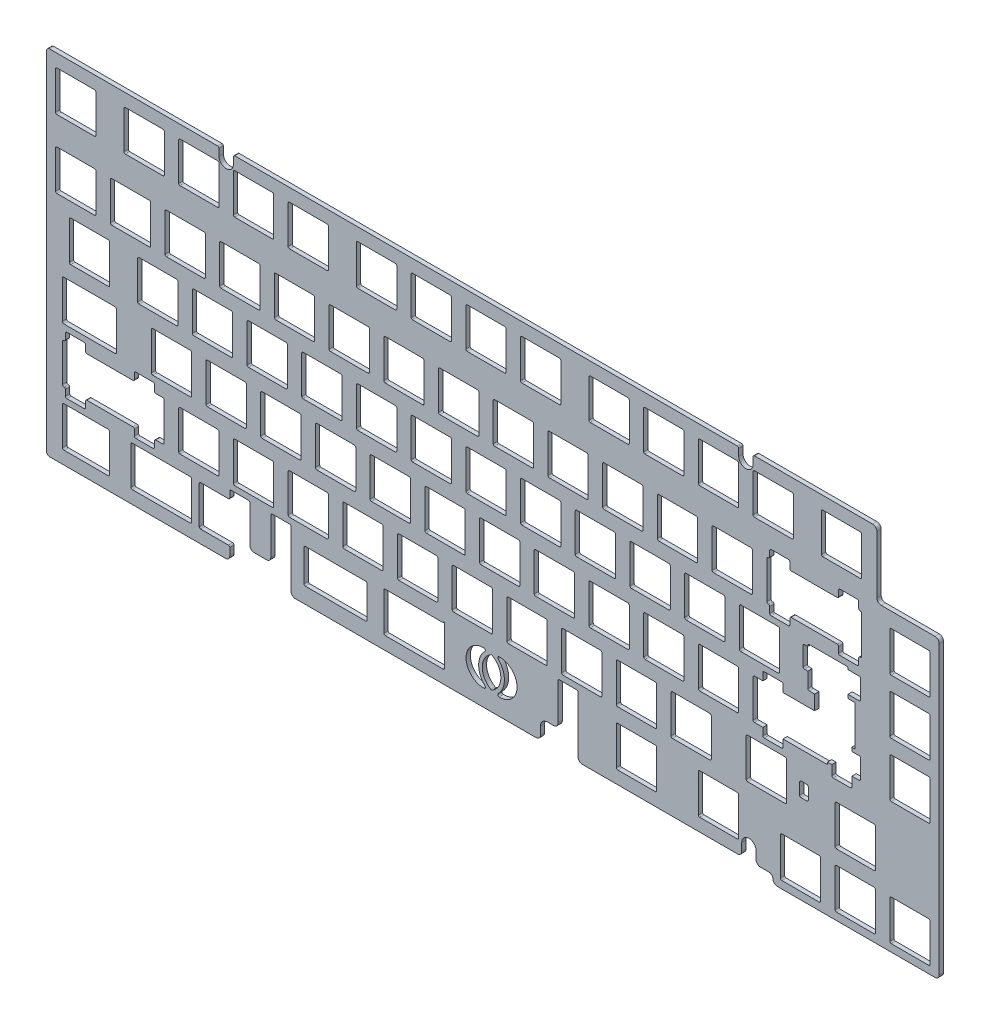
from build123d import *

# Parameters (mm, degrees)
BOSS_EXTRUDE1_DEPTH = 1.5
CUT_EXTRUDE1_DEPTH  = 10
FILLET1_R           = 0.5


with BuildPart() as part:
    # Model → Boss-Extrude1 (new body)
    with BuildSketch(Plane.XY):
        with BuildLine():
            ThreePointArc((9.955298424, 130.969514546), (9.177480965, 130.647332005), (8.855298424, 129.869514546))
            Line((8.855298424, 129.869514546), (8.855298424, 9.057014546))
            ThreePointArc((8.855298424, 9.057014546), (9.177480965, 8.279197086), (9.955298424, 7.957014546))
            Line((9.955298424, 7.957014546), (71.206983424, 7.957014546))
            ThreePointArc((71.206983424, 7.957014546), (72.267643596, 8.396354374), (72.706983424, 9.457014546))
            Line((72.706983424, 9.457014546), (72.706983424, 11.957014546))
            ThreePointArc((72.706983424, 11.957014546), (72.560536815, 12.310567936), (72.206983424, 12.457014546))
            Line((72.206983424, 12.457014546), (62.559375038, 12.457014546))
            ThreePointArc((62.559375038, 12.457014546), (62.205821647, 12.603461155), (62.059375038, 12.957014546))
            Line((62.059375038, 12.957014546), (62.059375038, 25.957014546))
            ThreePointArc((62.059375038, 25.957014546), (62.205821647, 26.310567936), (62.559375038, 26.457014546))
            Line((62.559375038, 26.457014546), (72.206983424, 26.457014546))
            ThreePointArc((72.206983424, 26.457014546), (72.560536815, 26.603461155), (72.706983424, 26.957014546))
            Line((72.706983424, 26.957014546), (72.706983424, 28.958014546))
            ThreePointArc((72.706983424, 28.958014546), (72.853430033, 29.311567936), (73.206983424, 29.458014546))
            Line((73.206983424, 29.458014546), (79.206983424, 29.458014546))
            ThreePointArc((79.206983424, 29.458014546), (79.560536815, 29.311567936), (79.706983424, 28.958014546))
            Line((79.706983424, 28.958014546), (79.706983424, 16.157014546))
            ThreePointArc((79.706983424, 16.157014546), (80.146323252, 15.096354374), (81.206983424, 14.657014546))
            Line((81.206983424, 14.657014546), (85.495873424, 14.657014546))
            ThreePointArc((85.495873424, 14.657014546), (86.556533596, 15.096354374), (86.995873424, 16.157014546))
            Line((86.995873424, 16.157014546), (86.995873424, 28.958014546))
            ThreePointArc((86.995873424, 28.958014546), (87.142320033, 29.311567936), (87.495873424, 29.458014546))
            Line((87.495873424, 29.458014546), (93.495873424, 29.458014546))
            ThreePointArc((93.495873424, 29.458014546), (93.849426815, 29.311567936), (93.995873424, 28.958014546))
            Line((93.995873424, 28.958014546), (93.995873424, 9.457014546))
            ThreePointArc((93.995873424, 9.457014546), (94.435213252, 8.396354374), (95.495873424, 7.957014546))
            Line((95.495873424, 7.957014546), (179.362538424, 7.957014546))
            ThreePointArc((179.362538424, 7.957014546), (180.423198596, 8.396354374), (180.862538424, 9.457014546))
            Line((180.862538424, 9.457014546), (180.862538424, 12.157014546))
            ThreePointArc((180.862538424, 12.157014546), (181.594771471, 13.924781498), (183.362538424, 14.657014546))
            Line((183.362538424, 14.657014546), (185.495872282, 14.657014546))
            ThreePointArc((185.495872282, 14.657014546), (186.556532454, 15.096354374), (186.995872282, 16.157014546))
            Line((186.995872282, 16.157014546), (186.995872282, 28.958013975))
            ThreePointArc((186.995872282, 28.958013975), (187.14231869, 29.311567734), (187.495872282, 29.458014546))
            Line((187.495872282, 29.458014546), (193.495873424, 29.458014546))
            ThreePointArc((193.495873424, 29.458014546), (193.849426815, 29.311567936), (193.995873424, 28.958014546))
            Line((193.995873424, 28.958014546), (193.995873424, 9.457014546))
            ThreePointArc((193.995873424, 9.457014546), (194.435213252, 8.396354374), (195.495873424, 7.957014546))
            Line((195.495873424, 7.957014546), (249.492798424, 7.957014546))
            ThreePointArc((249.492798424, 7.957014546), (250.553458596, 8.396354374), (250.992798424, 9.457014546))
            Line((250.992798424, 9.457014546), (250.992798424, 12.157014546))
            ThreePointArc((250.992798424, 12.157014546), (253.492798424, 14.657014546), (255.992798424, 12.157014546))
            Line((255.992798424, 12.157014546), (255.992798424, 9.457014546))
            ThreePointArc((255.992798424, 9.457014546), (256.432138252, 8.396354374), (257.492798424, 7.957014546))
            Line((257.492798424, 7.957014546), (260.370951122, 7.957014546))
            ThreePointArc((260.370951122, 7.957014546), (261.407019411, 7.541709203), (261.869374773, 6.525764546))
            ThreePointArc((261.869374773, 6.525764546), (262.331730135, 5.509819888), (263.367798424, 5.094514546))
            Line((263.367798424, 5.094514546), (318.267798424, 5.094514546))
            ThreePointArc((318.267798424, 5.094514546), (319.328458596, 5.533854374), (319.767798424, 6.594514546))
            Line((319.767798424, 6.594514546), (319.767798424, 106.45317864))
            ThreePointArc((319.767798424, 106.45317864), (319.328458596, 107.513838812), (318.267798424, 107.95317864))
            Line((318.267798424, 107.95317864), (299.555298424, 107.95317864))
            ThreePointArc((299.555298424, 107.95317864), (298.494638252, 108.392518468), (298.055298424, 109.45317864))
            Line((298.055298424, 109.45317864), (298.055298424, 129.469514546))
            ThreePointArc((298.055298424, 129.469514546), (297.615958596, 130.530174717), (296.555298424, 130.969514546))
            Line((296.555298424, 130.969514546), (9.955298424, 130.969514546))
        make_face()
        with BuildLine():
            ThreePointArc((14.934285038, 12.457014546), (14.580731647, 12.603461155), (14.434285038, 12.957014546))
            Line((14.434285038, 12.957014546), (14.434285038, 25.957014546))
            ThreePointArc((14.434285038, 25.957014546), (14.580731647, 26.310567936), (14.934285038, 26.457014546))
            Line((14.934285038, 26.457014546), (30.319483424, 26.457014546))
            ThreePointArc((30.319483424, 26.457014546), (30.673036815, 26.310567936), (30.819483424, 25.957014546))
            Line((30.819483424, 25.957014546), (30.819483424, 12.957014546))
            ThreePointArc((30.819483424, 12.957014546), (30.673036815, 12.603461155), (30.319483424, 12.457014546))
            Line((30.319483424, 12.457014546), (14.934285038, 12.457014546))
        make_face(mode=Mode.SUBTRACT)
        with BuildLine():
            ThreePointArc((38.745375038, 12.457014546), (38.391821647, 12.603461155), (38.245375038, 12.957014546))
            Line((38.245375038, 12.957014546), (38.245375038, 25.957014546))
            ThreePointArc((38.245375038, 25.957014546), (38.391821647, 26.310567936), (38.745375038, 26.457014546))
            Line((38.745375038, 26.457014546), (58.894483424, 26.457014546))
            ThreePointArc((58.894483424, 26.457014546), (59.248036815, 26.310567936), (59.394483424, 25.957014546))
            Line((59.394483424, 25.957014546), (59.394483424, 12.957014546))
            ThreePointArc((59.394483424, 12.957014546), (59.248036815, 12.603461155), (58.894483424, 12.457014546))
            Line((58.894483424, 12.457014546), (38.745375038, 12.457014546))
        make_face(mode=Mode.SUBTRACT)
        with BuildLine():
            Line((120.541283424, 24.957014546), (120.541283424, 13.957014546))
            ThreePointArc((120.541283424, 13.957014546), (120.394836815, 13.603461155), (120.041283424, 13.457014546))
            Line((120.041283424, 13.457014546), (99.041283424, 13.457014546))
            ThreePointArc((99.041283424, 13.457014546), (98.687730033, 13.603461155), (98.541283424, 13.957014546))
            Line((98.541283424, 13.957014546), (98.541283424, 24.957014546))
            ThreePointArc((98.541283424, 24.957014546), (98.687730033, 25.310567936), (99.041283424, 25.457014546))
            Line((99.041283424, 25.457014546), (120.041283424, 25.457014546))
            ThreePointArc((120.041283424, 25.457014546), (120.394836815, 25.310567936), (120.541283424, 24.957014546))
        make_face(mode=Mode.SUBTRACT)
        with BuildLine():
            ThreePointArc((126.856983424, 12.457014546), (126.503430033, 12.603461155), (126.356983424, 12.957014546))
            Line((126.356983424, 12.957014546), (126.356983424, 25.957014546))
            ThreePointArc((126.356983424, 25.957014546), (126.503430033, 26.310567936), (126.856983424, 26.457014546))
            Line((126.856983424, 26.457014546), (146.995875038, 26.457014546))
            ThreePointArc((146.995875038, 26.457014546), (147.192055678, 26.702383251), (147.495875038, 26.782298463))
            Line((147.495875038, 26.782298463), (147.495875038, 12.957014546))
            ThreePointArc((147.495875038, 12.957014546), (147.349428429, 12.603461155), (146.995875038, 12.457014546))
            Line((146.995875038, 12.457014546), (126.856983424, 12.457014546))
        make_face(mode=Mode.SUBTRACT)
        with BuildLine():
            Line((15.463233424, 46.007014546), (15.463233424, 48.007314546))
            ThreePointArc((15.463233424, 48.007314546), (15.609680033, 48.360867936), (15.963233424, 48.507314546))
            Line((15.963233424, 48.507314546), (21.963233424, 48.507314546))
            ThreePointArc((21.963233424, 48.507314546), (22.316786815, 48.360867936), (22.463233424, 48.007314546))
            Line((22.463233424, 48.007314546), (22.463233424, 46.007314546))
            ThreePointArc((22.463233424, 46.007314546), (22.609680033, 45.653761155), (22.963233424, 45.507314546))
            Line((22.963233424, 45.507314546), (38.963233424, 45.507314546))
            ThreePointArc((38.963233424, 45.507314546), (39.316786815, 45.653761155), (39.463233424, 46.007314546))
            Line((39.463233424, 46.007314546), (39.463233424, 48.007314546))
            ThreePointArc((39.463233424, 48.007314546), (39.609680033, 48.360867936), (39.963233424, 48.507314546))
            Line((39.963233424, 48.507314546), (45.963233424, 48.507314546))
            ThreePointArc((45.963233424, 48.507314546), (46.316786815, 48.360867936), (46.463233424, 48.007314546))
            Line((46.463233424, 48.007314546), (46.463233424, 46.007014546))
            ThreePointArc((46.463233424, 46.007014546), (46.609680033, 45.653461155), (46.963233424, 45.507014546))
            Line((46.963233424, 45.507014546), (49.367798424, 45.507014546))
            ThreePointArc((49.367798424, 45.507014546), (49.721351815, 45.360567936), (49.867798424, 45.007014546))
            Line((49.867798424, 45.007014546), (49.867798424, 32.007014546))
            ThreePointArc((49.867798424, 32.007014546), (49.721351815, 31.653461155), (49.367798424, 31.507014546))
            Line((49.367798424, 31.507014546), (46.963233424, 31.507014546))
            ThreePointArc((46.963233424, 31.507014546), (46.609680033, 31.360567936), (46.463233424, 31.007014546))
            Line((46.463233424, 31.007014546), (46.463233424, 29.007314546))
            ThreePointArc((46.463233424, 29.007314546), (46.316786815, 28.653761155), (45.963233424, 28.507314546))
            Line((45.963233424, 28.507314546), (39.963233424, 28.507314546))
            ThreePointArc((39.963233424, 28.507314546), (39.609680033, 28.653761155), (39.463233424, 29.007314546))
            Line((39.463233424, 29.007314546), (39.463233424, 31.007314546))
            ThreePointArc((39.463233424, 31.007314546), (39.316786815, 31.360867936), (38.963233424, 31.507314546))
            Line((38.963233424, 31.507314546), (22.963233424, 31.507314546))
            ThreePointArc((22.963233424, 31.507314546), (22.609680033, 31.360867936), (22.463233424, 31.007314546))
            Line((22.463233424, 31.007314546), (22.463233424, 29.007314546))
            ThreePointArc((22.463233424, 29.007314546), (22.316786815, 28.653761155), (21.963233424, 28.507314546))
            Line((21.963233424, 28.507314546), (15.963233424, 28.507314546))
            ThreePointArc((15.963233424, 28.507314546), (15.609680033, 28.653761155), (15.463233424, 29.007314546))
            Line((15.463233424, 29.007314546), (15.463233424, 31.007014546))
            ThreePointArc((15.463233424, 31.007014546), (15.316786815, 31.360567936), (14.963233424, 31.507014546))
            Line((14.963233424, 31.507014546), (14.936548424, 31.507014546))
            ThreePointArc((14.936548424, 31.507014546), (14.582995033, 31.653461155), (14.436548424, 32.007014546))
            Line((14.436548424, 32.007014546), (14.436548424, 45.007014546))
            ThreePointArc((14.436548424, 45.007014546), (14.582995033, 45.360567936), (14.936548424, 45.507014546))
            Line((14.936548424, 45.507014546), (14.963233424, 45.507014546))
            ThreePointArc((14.963233424, 45.507014546), (15.316786815, 45.653461155), (15.463233424, 46.007014546))
        make_face(mode=Mode.SUBTRACT)
        with BuildLine():
            Line((68.442798424, 31.482014546), (55.392798424, 31.482014546))
            ThreePointArc((55.392798424, 31.482014546), (55.039245033, 31.628461155), (54.892798424, 31.982014546))
            Line((54.892798424, 31.982014546), (54.892798424, 45.032014546))
            ThreePointArc((54.892798424, 45.032014546), (55.039245033, 45.385567936), (55.392798424, 45.532014546))
            Line((55.392798424, 45.532014546), (68.442798424, 45.532014546))
            ThreePointArc((68.442798424, 45.532014546), (68.796351815, 45.385567936), (68.942798424, 45.032014546))
            Line((68.942798424, 45.032014546), (68.942798424, 31.982014546))
            ThreePointArc((68.942798424, 31.982014546), (68.796351815, 31.628461155), (68.442798424, 31.482014546))
        make_face(mode=Mode.SUBTRACT)
        with BuildLine():
            Line((87.492798424, 31.482014546), (74.442798424, 31.482014546))
            ThreePointArc((74.442798424, 31.482014546), (74.089245033, 31.628461155), (73.942798424, 31.982014546))
            Line((73.942798424, 31.982014546), (73.942798424, 45.032014546))
            ThreePointArc((73.942798424, 45.032014546), (74.089245033, 45.385567936), (74.442798424, 45.532014546))
            Line((74.442798424, 45.532014546), (87.492798424, 45.532014546))
            ThreePointArc((87.492798424, 45.532014546), (87.846351815, 45.385567936), (87.992798424, 45.032014546))
            Line((87.992798424, 45.032014546), (87.992798424, 31.982014546))
            ThreePointArc((87.992798424, 31.982014546), (87.846351815, 31.628461155), (87.492798424, 31.482014546))
        make_face(mode=Mode.SUBTRACT)
        with BuildLine():
            ThreePointArc((33.249048424, 51.057014546), (33.087957154, 50.668105816), (32.699048424, 50.507014546))
            Line((32.699048424, 50.507014546), (14.936548424, 50.507014546))
            ThreePointArc((14.936548424, 50.507014546), (14.547639694, 50.668105816), (14.386548424, 51.057014546))
            Line((14.386548424, 51.057014546), (14.386548424, 64.057014546))
            ThreePointArc((14.386548424, 64.057014546), (14.547639694, 64.445923275), (14.936548424, 64.607014546))
            Line((14.936548424, 64.607014546), (32.699048424, 64.607014546))
            ThreePointArc((32.699048424, 64.607014546), (33.087957154, 64.445923275), (33.249048424, 64.057014546))
            Line((33.249048424, 64.057014546), (33.249048424, 51.057014546))
        make_face(mode=Mode.SUBTRACT)
        with BuildLine():
            Line((58.917798424, 50.532014546), (45.867798424, 50.532014546))
            ThreePointArc((45.867798424, 50.532014546), (45.514245033, 50.678461155), (45.367798424, 51.032014546))
            Line((45.367798424, 51.032014546), (45.367798424, 64.082014546))
            ThreePointArc((45.367798424, 64.082014546), (45.514245033, 64.435567936), (45.867798424, 64.582014546))
            Line((45.867798424, 64.582014546), (58.917798424, 64.582014546))
            ThreePointArc((58.917798424, 64.582014546), (59.271351815, 64.435567936), (59.417798424, 64.082014546))
            Line((59.417798424, 64.082014546), (59.417798424, 51.032014546))
            ThreePointArc((59.417798424, 51.032014546), (59.271351815, 50.678461155), (58.917798424, 50.532014546))
        make_face(mode=Mode.SUBTRACT)
        with BuildLine():
            Line((77.967798424, 50.532014546), (64.917798424, 50.532014546))
            ThreePointArc((64.917798424, 50.532014546), (64.564245033, 50.678461155), (64.417798424, 51.032014546))
            Line((64.417798424, 51.032014546), (64.417798424, 64.082014546))
            ThreePointArc((64.417798424, 64.082014546), (64.564245033, 64.435567936), (64.917798424, 64.582014546))
            Line((64.917798424, 64.582014546), (77.967798424, 64.582014546))
            ThreePointArc((77.967798424, 64.582014546), (78.321351815, 64.435567936), (78.467798424, 64.082014546))
            Line((78.467798424, 64.082014546), (78.467798424, 51.032014546))
            ThreePointArc((78.467798424, 51.032014546), (78.321351815, 50.678461155), (77.967798424, 50.532014546))
        make_face(mode=Mode.SUBTRACT)
        with BuildLine():
            Line((106.542798424, 31.482014546), (93.492798424, 31.482014546))
            ThreePointArc((93.492798424, 31.482014546), (93.139245033, 31.628461155), (92.992798424, 31.982014546))
            Line((92.992798424, 31.982014546), (92.992798424, 45.032014546))
            ThreePointArc((92.992798424, 45.032014546), (93.139245033, 45.385567936), (93.492798424, 45.532014546))
            Line((93.492798424, 45.532014546), (106.542798424, 45.532014546))
            ThreePointArc((106.542798424, 45.532014546), (106.896351815, 45.385567936), (107.042798424, 45.032014546))
            Line((107.042798424, 45.032014546), (107.042798424, 31.982014546))
            ThreePointArc((107.042798424, 31.982014546), (106.896351815, 31.628461155), (106.542798424, 31.482014546))
        make_face(mode=Mode.SUBTRACT)
        with BuildLine():
            Line((125.592798424, 31.482014546), (112.542798424, 31.482014546))
            ThreePointArc((112.542798424, 31.482014546), (112.189245033, 31.628461155), (112.042798424, 31.982014546))
            Line((112.042798424, 31.982014546), (112.042798424, 45.032014546))
            ThreePointArc((112.042798424, 45.032014546), (112.189245033, 45.385567936), (112.542798424, 45.532014546))
            Line((112.542798424, 45.532014546), (125.592798424, 45.532014546))
            ThreePointArc((125.592798424, 45.532014546), (125.946351815, 45.385567936), (126.092798424, 45.032014546))
            Line((126.092798424, 45.032014546), (126.092798424, 31.982014546))
            ThreePointArc((126.092798424, 31.982014546), (125.946351815, 31.628461155), (125.592798424, 31.482014546))
        make_face(mode=Mode.SUBTRACT)
        with BuildLine():
            Line((144.642798424, 31.482014546), (131.592798424, 31.482014546))
            ThreePointArc((131.592798424, 31.482014546), (131.239245033, 31.628461155), (131.092798424, 31.982014546))
            Line((131.092798424, 31.982014546), (131.092798424, 45.032014546))
            ThreePointArc((131.092798424, 45.032014546), (131.239245033, 45.385567936), (131.592798424, 45.532014546))
            Line((131.592798424, 45.532014546), (144.642798424, 45.532014546))
            ThreePointArc((144.642798424, 45.532014546), (144.996351815, 45.385567936), (145.142798424, 45.032014546))
            Line((145.142798424, 45.032014546), (145.142798424, 31.982014546))
            ThreePointArc((145.142798424, 31.982014546), (144.996351815, 31.628461155), (144.642798424, 31.482014546))
        make_face(mode=Mode.SUBTRACT)
        with BuildLine():
            Line((163.692798424, 31.482014546), (150.642798424, 31.482014546))
            ThreePointArc((150.642798424, 31.482014546), (150.289245033, 31.628461155), (150.142798424, 31.982014546))
            Line((150.142798424, 31.982014546), (150.142798424, 45.032014546))
            ThreePointArc((150.142798424, 45.032014546), (150.289245033, 45.385567936), (150.642798424, 45.532014546))
            Line((150.642798424, 45.532014546), (163.692798424, 45.532014546))
            ThreePointArc((163.692798424, 45.532014546), (164.046351815, 45.385567936), (164.192798424, 45.032014546))
            Line((164.192798424, 45.032014546), (164.192798424, 31.982014546))
            ThreePointArc((164.192798424, 31.982014546), (164.046351815, 31.628461155), (163.692798424, 31.482014546))
        make_face(mode=Mode.SUBTRACT)
        with BuildLine():
            Line((97.017798424, 50.532014546), (83.967798424, 50.532014546))
            ThreePointArc((83.967798424, 50.532014546), (83.614245033, 50.678461155), (83.467798424, 51.032014546))
            Line((83.467798424, 51.032014546), (83.467798424, 64.082014546))
            ThreePointArc((83.467798424, 64.082014546), (83.614245033, 64.435567936), (83.967798424, 64.582014546))
            Line((83.967798424, 64.582014546), (97.017798424, 64.582014546))
            ThreePointArc((97.017798424, 64.582014546), (97.371351815, 64.435567936), (97.517798424, 64.082014546))
            Line((97.517798424, 64.082014546), (97.517798424, 51.032014546))
            ThreePointArc((97.517798424, 51.032014546), (97.371351815, 50.678461155), (97.017798424, 50.532014546))
        make_face(mode=Mode.SUBTRACT)
        with BuildLine():
            Line((116.067798424, 50.532014546), (103.017798424, 50.532014546))
            ThreePointArc((103.017798424, 50.532014546), (102.664245033, 50.678461155), (102.517798424, 51.032014546))
            Line((102.517798424, 51.032014546), (102.517798424, 64.082014546))
            ThreePointArc((102.517798424, 64.082014546), (102.664245033, 64.435567936), (103.017798424, 64.582014546))
            Line((103.017798424, 64.582014546), (116.067798424, 64.582014546))
            ThreePointArc((116.067798424, 64.582014546), (116.421351815, 64.435567936), (116.567798424, 64.082014546))
            Line((116.567798424, 64.082014546), (116.567798424, 51.032014546))
            ThreePointArc((116.567798424, 51.032014546), (116.421351815, 50.678461155), (116.067798424, 50.532014546))
        make_face(mode=Mode.SUBTRACT)
        with BuildLine():
            Line((135.117798424, 50.532014546), (122.067798424, 50.532014546))
            ThreePointArc((122.067798424, 50.532014546), (121.714245033, 50.678461155), (121.567798424, 51.032014546))
            Line((121.567798424, 51.032014546), (121.567798424, 64.082014546))
            ThreePointArc((121.567798424, 64.082014546), (121.714245033, 64.435567936), (122.067798424, 64.582014546))
            Line((122.067798424, 64.582014546), (135.117798424, 64.582014546))
            ThreePointArc((135.117798424, 64.582014546), (135.471351815, 64.435567936), (135.617798424, 64.082014546))
            Line((135.617798424, 64.082014546), (135.617798424, 51.032014546))
            ThreePointArc((135.617798424, 51.032014546), (135.471351815, 50.678461155), (135.117798424, 50.532014546))
        make_face(mode=Mode.SUBTRACT)
        with BuildLine():
            Line((154.167798424, 50.532014546), (141.117798424, 50.532014546))
            ThreePointArc((141.117798424, 50.532014546), (140.764245033, 50.678461155), (140.617798424, 51.032014546))
            Line((140.617798424, 51.032014546), (140.617798424, 64.082014546))
            ThreePointArc((140.617798424, 64.082014546), (140.764245033, 64.435567936), (141.117798424, 64.582014546))
            Line((141.117798424, 64.582014546), (154.167798424, 64.582014546))
            ThreePointArc((154.167798424, 64.582014546), (154.521351815, 64.435567936), (154.667798424, 64.082014546))
            Line((154.667798424, 64.082014546), (154.667798424, 51.032014546))
            ThreePointArc((154.667798424, 51.032014546), (154.521351815, 50.678461155), (154.167798424, 50.532014546))
        make_face(mode=Mode.SUBTRACT)
        with BuildLine():
            Line((220.842798424, 12.432014546), (207.792798424, 12.432014546))
            ThreePointArc((207.792798424, 12.432014546), (207.439245033, 12.578461155), (207.292798424, 12.932014546))
            Line((207.292798424, 12.932014546), (207.292798424, 25.982014546))
            ThreePointArc((207.292798424, 25.982014546), (207.439245033, 26.335567936), (207.792798424, 26.482014546))
            Line((207.792798424, 26.482014546), (220.842798424, 26.482014546))
            ThreePointArc((220.842798424, 26.482014546), (221.196351815, 26.335567936), (221.342798424, 25.982014546))
            Line((221.342798424, 25.982014546), (221.342798424, 12.932014546))
            ThreePointArc((221.342798424, 12.932014546), (221.196351815, 12.578461155), (220.842798424, 12.432014546))
        make_face(mode=Mode.SUBTRACT)
        with BuildLine():
            Line((249.417798424, 12.432014546), (236.367798424, 12.432014546))
            ThreePointArc((236.367798424, 12.432014546), (236.014245033, 12.578461155), (235.867798424, 12.932014546))
            Line((235.867798424, 12.932014546), (235.867798424, 25.982014546))
            ThreePointArc((235.867798424, 25.982014546), (236.014245033, 26.335567936), (236.367798424, 26.482014546))
            Line((236.367798424, 26.482014546), (249.417798424, 26.482014546))
            ThreePointArc((249.417798424, 26.482014546), (249.771351815, 26.335567936), (249.917798424, 25.982014546))
            Line((249.917798424, 25.982014546), (249.917798424, 12.932014546))
            ThreePointArc((249.917798424, 12.932014546), (249.771351815, 12.578461155), (249.417798424, 12.432014546))
        make_face(mode=Mode.SUBTRACT)
        with BuildLine():
            Line((277.992798424, 7.669514546), (264.942798424, 7.669514546))
            ThreePointArc((264.942798424, 7.669514546), (264.589245033, 7.815961155), (264.442798424, 8.169514546))
            Line((264.442798424, 8.169514546), (264.442798424, 21.219514546))
            ThreePointArc((264.442798424, 21.219514546), (264.589245033, 21.573067936), (264.942798424, 21.719514546))
            Line((264.942798424, 21.719514546), (277.992798424, 21.719514546))
            ThreePointArc((277.992798424, 21.719514546), (278.346351815, 21.573067936), (278.492798424, 21.219514546))
            Line((278.492798424, 21.219514546), (278.492798424, 8.169514546))
            ThreePointArc((278.492798424, 8.169514546), (278.346351815, 7.815961155), (277.992798424, 7.669514546))
        make_face(mode=Mode.SUBTRACT)
        with BuildLine():
            Line((297.042798424, 7.669514546), (283.992798424, 7.669514546))
            ThreePointArc((283.992798424, 7.669514546), (283.639245033, 7.815961155), (283.492798424, 8.169514546))
            Line((283.492798424, 8.169514546), (283.492798424, 21.219514546))
            ThreePointArc((283.492798424, 21.219514546), (283.639245033, 21.573067936), (283.992798424, 21.719514546))
            Line((283.992798424, 21.719514546), (297.042798424, 21.719514546))
            ThreePointArc((297.042798424, 21.719514546), (297.396351815, 21.573067936), (297.542798424, 21.219514546))
            Line((297.542798424, 21.219514546), (297.542798424, 8.169514546))
            ThreePointArc((297.542798424, 8.169514546), (297.396351815, 7.815961155), (297.042798424, 7.669514546))
        make_face(mode=Mode.SUBTRACT)
        with BuildLine():
            Line((316.092798424, 7.669514546), (303.042798424, 7.669514546))
            ThreePointArc((303.042798424, 7.669514546), (302.689245033, 7.815961155), (302.542798424, 8.169514546))
            Line((302.542798424, 8.169514546), (302.542798424, 21.219514546))
            ThreePointArc((302.542798424, 21.219514546), (302.689245033, 21.573067936), (303.042798424, 21.719514546))
            Line((303.042798424, 21.719514546), (316.092798424, 21.719514546))
            ThreePointArc((316.092798424, 21.719514546), (316.446351815, 21.573067936), (316.592798424, 21.219514546))
            Line((316.592798424, 21.219514546), (316.592798424, 8.169514546))
            ThreePointArc((316.592798424, 8.169514546), (316.446351815, 7.815961155), (316.092798424, 7.669514546))
        make_face(mode=Mode.SUBTRACT)
        with BuildLine():
            Line((297.042798424, 26.719514546), (283.992798424, 26.719514546))
            ThreePointArc((283.992798424, 26.719514546), (283.639245033, 26.865961155), (283.492798424, 27.219514546))
            Line((283.492798424, 27.219514546), (283.492798424, 40.269514546))
            ThreePointArc((283.492798424, 40.269514546), (283.639245033, 40.623067936), (283.992798424, 40.769514546))
            Line((283.992798424, 40.769514546), (297.042798424, 40.769514546))
            ThreePointArc((297.042798424, 40.769514546), (297.396351815, 40.623067936), (297.542798424, 40.269514546))
            Line((297.542798424, 40.269514546), (297.542798424, 27.219514546))
            ThreePointArc((297.542798424, 27.219514546), (297.396351815, 26.865961155), (297.042798424, 26.719514546))
        make_face(mode=Mode.SUBTRACT)
        with BuildLine():
            Line((182.742798424, 31.482014546), (169.692798424, 31.482014546))
            ThreePointArc((169.692798424, 31.482014546), (169.339245033, 31.628461155), (169.192798424, 31.982014546))
            Line((169.192798424, 31.982014546), (169.192798424, 45.032014546))
            ThreePointArc((169.192798424, 45.032014546), (169.339245033, 45.385567936), (169.692798424, 45.532014546))
            Line((169.692798424, 45.532014546), (182.742798424, 45.532014546))
            ThreePointArc((182.742798424, 45.532014546), (183.096351815, 45.385567936), (183.242798424, 45.032014546))
            Line((183.242798424, 45.032014546), (183.242798424, 31.982014546))
            ThreePointArc((183.242798424, 31.982014546), (183.096351815, 31.628461155), (182.742798424, 31.482014546))
        make_face(mode=Mode.SUBTRACT)
        with BuildLine():
            Line((201.792798424, 31.482014546), (188.742798424, 31.482014546))
            ThreePointArc((188.742798424, 31.482014546), (188.389245033, 31.628461155), (188.242798424, 31.982014546))
            Line((188.242798424, 31.982014546), (188.242798424, 45.032014546))
            ThreePointArc((188.242798424, 45.032014546), (188.389245033, 45.385567936), (188.742798424, 45.532014546))
            Line((188.742798424, 45.532014546), (201.792798424, 45.532014546))
            ThreePointArc((201.792798424, 45.532014546), (202.146351815, 45.385567936), (202.292798424, 45.032014546))
            Line((202.292798424, 45.032014546), (202.292798424, 31.982014546))
            ThreePointArc((202.292798424, 31.982014546), (202.146351815, 31.628461155), (201.792798424, 31.482014546))
        make_face(mode=Mode.SUBTRACT)
        with BuildLine():
            Line((220.842798424, 31.482014546), (207.792798424, 31.482014546))
            ThreePointArc((207.792798424, 31.482014546), (207.439245033, 31.628461155), (207.292798424, 31.982014546))
            Line((207.292798424, 31.982014546), (207.292798424, 45.032014546))
            ThreePointArc((207.292798424, 45.032014546), (207.439245033, 45.385567936), (207.792798424, 45.532014546))
            Line((207.792798424, 45.532014546), (220.842798424, 45.532014546))
            ThreePointArc((220.842798424, 45.532014546), (221.196351815, 45.385567936), (221.342798424, 45.032014546))
            Line((221.342798424, 45.032014546), (221.342798424, 31.982014546))
            ThreePointArc((221.342798424, 31.982014546), (221.196351815, 31.628461155), (220.842798424, 31.482014546))
        make_face(mode=Mode.SUBTRACT)
        with BuildLine():
            Line((239.892798424, 31.482014546), (226.842798424, 31.482014546))
            ThreePointArc((226.842798424, 31.482014546), (226.489245033, 31.628461155), (226.342798424, 31.982014546))
            Line((226.342798424, 31.982014546), (226.342798424, 45.032014546))
            ThreePointArc((226.342798424, 45.032014546), (226.489245033, 45.385567936), (226.842798424, 45.532014546))
            Line((226.842798424, 45.532014546), (239.892798424, 45.532014546))
            ThreePointArc((239.892798424, 45.532014546), (240.246351815, 45.385567936), (240.392798424, 45.032014546))
            Line((240.392798424, 45.032014546), (240.392798424, 31.982014546))
            ThreePointArc((240.392798424, 31.982014546), (240.246351815, 31.628461155), (239.892798424, 31.482014546))
        make_face(mode=Mode.SUBTRACT)
        with BuildLine():
            Line((173.217798424, 50.532014546), (160.167798424, 50.532014546))
            ThreePointArc((160.167798424, 50.532014546), (159.814245033, 50.678461155), (159.667798424, 51.032014546))
            Line((159.667798424, 51.032014546), (159.667798424, 64.082014546))
            ThreePointArc((159.667798424, 64.082014546), (159.814245033, 64.435567936), (160.167798424, 64.582014546))
            Line((160.167798424, 64.582014546), (173.217798424, 64.582014546))
            ThreePointArc((173.217798424, 64.582014546), (173.571351815, 64.435567936), (173.717798424, 64.082014546))
            Line((173.717798424, 64.082014546), (173.717798424, 51.032014546))
            ThreePointArc((173.717798424, 51.032014546), (173.571351815, 50.678461155), (173.217798424, 50.532014546))
        make_face(mode=Mode.SUBTRACT)
        with BuildLine():
            Line((192.267798424, 50.532014546), (179.217798424, 50.532014546))
            ThreePointArc((179.217798424, 50.532014546), (178.864245033, 50.678461155), (178.717798424, 51.032014546))
            Line((178.717798424, 51.032014546), (178.717798424, 64.082014546))
            ThreePointArc((178.717798424, 64.082014546), (178.864245033, 64.435567936), (179.217798424, 64.582014546))
            Line((179.217798424, 64.582014546), (192.267798424, 64.582014546))
            ThreePointArc((192.267798424, 64.582014546), (192.621351815, 64.435567936), (192.767798424, 64.082014546))
            Line((192.767798424, 64.082014546), (192.767798424, 51.032014546))
            ThreePointArc((192.767798424, 51.032014546), (192.621351815, 50.678461155), (192.267798424, 50.532014546))
        make_face(mode=Mode.SUBTRACT)
        with BuildLine():
            Line((211.317798424, 50.532014546), (198.267798424, 50.532014546))
            ThreePointArc((198.267798424, 50.532014546), (197.914245033, 50.678461155), (197.767798424, 51.032014546))
            Line((197.767798424, 51.032014546), (197.767798424, 64.082014546))
            ThreePointArc((197.767798424, 64.082014546), (197.914245033, 64.435567936), (198.267798424, 64.582014546))
            Line((198.267798424, 64.582014546), (211.317798424, 64.582014546))
            ThreePointArc((211.317798424, 64.582014546), (211.671351815, 64.435567936), (211.817798424, 64.082014546))
            Line((211.817798424, 64.082014546), (211.817798424, 51.032014546))
            ThreePointArc((211.817798424, 51.032014546), (211.671351815, 50.678461155), (211.317798424, 50.532014546))
        make_face(mode=Mode.SUBTRACT)
        with BuildLine():
            Line((230.367798424, 50.532014546), (217.317798424, 50.532014546))
            ThreePointArc((217.317798424, 50.532014546), (216.964245033, 50.678461155), (216.817798424, 51.032014546))
            Line((216.817798424, 51.032014546), (216.817798424, 64.082014546))
            ThreePointArc((216.817798424, 64.082014546), (216.964245033, 64.435567936), (217.317798424, 64.582014546))
            Line((217.317798424, 64.582014546), (230.367798424, 64.582014546))
            ThreePointArc((230.367798424, 64.582014546), (230.721351815, 64.435567936), (230.867798424, 64.082014546))
            Line((230.867798424, 64.082014546), (230.867798424, 51.032014546))
            ThreePointArc((230.867798424, 51.032014546), (230.721351815, 50.678461155), (230.367798424, 50.532014546))
        make_face(mode=Mode.SUBTRACT)
        with BuildLine():
            Line((266.086548424, 31.482014546), (253.036548424, 31.482014546))
            ThreePointArc((253.036548424, 31.482014546), (252.682995033, 31.628461155), (252.536548424, 31.982014546))
            Line((252.536548424, 31.982014546), (252.536548424, 45.032014546))
            ThreePointArc((252.536548424, 45.032014546), (252.682995033, 45.385567936), (253.036548424, 45.532014546))
            Line((253.036548424, 45.532014546), (266.086548424, 45.532014546))
            ThreePointArc((266.086548424, 45.532014546), (266.440101815, 45.385567936), (266.586548424, 45.032014546))
            Line((266.586548424, 45.032014546), (266.586548424, 31.982014546))
            ThreePointArc((266.586548424, 31.982014546), (266.440101815, 31.628461155), (266.086548424, 31.482014546))
        make_face(mode=Mode.SUBTRACT)
        with BuildLine():
            ThreePointArc((271.157173424, 40.507014546), (271.303620033, 40.860567936), (271.657173424, 41.007014546))
            Line((271.657173424, 41.007014546), (273.657173424, 41.007014546))
            ThreePointArc((273.657173424, 41.007014546), (274.010726815, 40.860567936), (274.157173424, 40.507014546))
            Line((274.157173424, 40.507014546), (274.157173424, 36.507014546))
            ThreePointArc((274.157173424, 36.507014546), (274.010726815, 36.153461155), (273.657173424, 36.007014546))
            Line((273.657173424, 36.007014546), (271.657173424, 36.007014546))
            ThreePointArc((271.657173424, 36.007014546), (271.303620033, 36.153461155), (271.157173424, 36.507014546))
            Line((271.157173424, 36.507014546), (271.157173424, 40.507014546))
        make_face(mode=Mode.SUBTRACT)
        with BuildLine():
            Line((249.417798424, 50.532014546), (236.367798424, 50.532014546))
            ThreePointArc((236.367798424, 50.532014546), (236.014245033, 50.678461155), (235.867798424, 51.032014546))
            Line((235.867798424, 51.032014546), (235.867798424, 64.082014546))
            ThreePointArc((235.867798424, 64.082014546), (236.014245033, 64.435567936), (236.367798424, 64.582014546))
            Line((236.367798424, 64.582014546), (249.417798424, 64.582014546))
            ThreePointArc((249.417798424, 64.582014546), (249.771351815, 64.435567936), (249.917798424, 64.082014546))
            Line((249.917798424, 64.082014546), (249.917798424, 51.032014546))
            ThreePointArc((249.917798424, 51.032014546), (249.771351815, 50.678461155), (249.417798424, 50.532014546))
        make_face(mode=Mode.SUBTRACT)
        with BuildLine():
            ThreePointArc((273.992798424, 83.107014546), (274.139245033, 83.460567936), (274.492798424, 83.607014546))
            Line((274.492798424, 83.607014546), (287.492798424, 83.607014546))
            ThreePointArc((287.492798424, 83.607014546), (287.846351815, 83.460567936), (287.992798424, 83.107014546))
            Line((287.992798424, 83.107014546), (287.995298424, 82.780068193))
            Line((287.995298424, 82.780068193), (291.850783424, 82.780068193))
            ThreePointArc((291.850783424, 82.780068193), (292.204336815, 82.633621584), (292.350783424, 82.280068193))
            Line((292.350783424, 82.280068193), (292.350783424, 75.842068193))
            ThreePointArc((292.350783424, 75.842068193), (292.204336815, 75.488514803), (291.850783424, 75.342068193))
            Line((291.850783424, 75.342068193), (287.995298424, 75.342068193))
            Line((287.995298424, 75.342068193), (287.995298424, 74.061068193))
            Line((287.995298424, 74.061068193), (290.376548424, 74.061068193))
            Line((290.376548424, 74.061068193), (290.376548424, 60.061068193))
            Line((290.376548424, 60.061068193), (289.350783424, 60.061068193))
            Line((289.350783424, 60.061068193), (289.350783424, 58.780068193))
            Line((289.350783424, 58.780068193), (291.850783424, 58.780068193))
            ThreePointArc((291.850783424, 58.780068193), (292.204336815, 58.633621584), (292.350783424, 58.280068193))
            Line((292.350783424, 58.280068193), (292.350783424, 51.842068193))
            ThreePointArc((292.350783424, 51.842068193), (292.204336815, 51.488514803), (291.850783424, 51.342068193))
            Line((291.850783424, 51.342068193), (289.350783424, 51.342068193))
            Line((289.350783424, 51.342068193), (289.350783424, 48.057014546))
            ThreePointArc((289.350783424, 48.057014546), (289.204336815, 47.703461155), (288.850783424, 47.557014546))
            Line((288.850783424, 47.557014546), (282.850783424, 47.557014546))
            ThreePointArc((282.850783424, 47.557014546), (282.497230033, 47.703461155), (282.350783424, 48.057014546))
            Line((282.350783424, 48.057014546), (282.350783424, 51.342068193))
            Line((282.350783424, 51.342068193), (280.851598424, 51.342068193))
            Line((280.851598424, 51.342068193), (280.851598424, 50.557014546))
            Line((280.851598424, 50.557014546), (265.350783424, 50.557014546))
            Line((265.350783424, 50.557014546), (265.350783424, 48.057014546))
            ThreePointArc((265.350783424, 48.057014546), (265.204336815, 47.703461155), (264.850783424, 47.557014546))
            Line((264.850783424, 47.557014546), (258.850783424, 47.557014546))
            ThreePointArc((258.850783424, 47.557014546), (258.497230033, 47.703461155), (258.350783424, 48.057014546))
            Line((258.350783424, 48.057014546), (258.350783424, 50.557014546))
            Line((258.350783424, 50.557014546), (255.445298424, 50.557014546))
            ThreePointArc((255.445298424, 50.557014546), (255.091745033, 50.703461155), (254.945298424, 51.057014546))
            Line((254.945298424, 51.057014546), (254.945298424, 64.057014546))
            ThreePointArc((254.945298424, 64.057014546), (255.091745033, 64.410567936), (255.445298424, 64.557014546))
            Line((255.445298424, 64.557014546), (258.350783424, 64.557014546))
            Line((258.350783424, 64.557014546), (258.350783424, 67.057014546))
            ThreePointArc((258.350783424, 67.057014546), (258.497230033, 67.410567936), (258.850783424, 67.557014546))
            Line((258.850783424, 67.557014546), (264.850783424, 67.557014546))
            ThreePointArc((264.850783424, 67.557014546), (265.204336815, 67.410567936), (265.350783424, 67.057014546))
            Line((265.350783424, 67.057014546), (265.350783424, 64.557014546))
            Line((265.350783424, 64.557014546), (276.376548424, 64.557014546))
            Line((276.376548424, 64.557014546), (276.376548424, 69.607014546))
            Line((276.376548424, 69.607014546), (274.492798424, 69.607014546))
            ThreePointArc((274.492798424, 69.607014546), (274.139245033, 69.753461155), (273.992798424, 70.107014546))
            Line((273.992798424, 70.107014546), (273.992798424, 75.342068193))
            Line((273.992798424, 75.342068193), (272.850783424, 75.342068193))
            ThreePointArc((272.850783424, 75.342068193), (272.497230033, 75.488514803), (272.350783424, 75.842068193))
            Line((272.350783424, 75.842068193), (272.350783424, 82.280068193))
            ThreePointArc((272.350783424, 82.280068193), (272.497230033, 82.633621584), (272.850783424, 82.780068193))
            Line((272.850783424, 82.780068193), (273.992798424, 82.780068193))
            Line((273.992798424, 82.780068193), (273.992798424, 83.107014546))
        make_face(mode=Mode.SUBTRACT)
        with BuildLine():
            ThreePointArc((302.542798424, 64.057014546), (302.696567364, 64.428245606), (303.067798424, 64.582014546))
            Line((303.067798424, 64.582014546), (316.117798424, 64.582014546))
            ThreePointArc((316.117798424, 64.582014546), (316.453674145, 64.442890267), (316.592798424, 64.107014546))
            Line((316.592798424, 64.107014546), (316.592798424, 51.057014546))
            ThreePointArc((316.592798424, 51.057014546), (316.439029484, 50.685783485), (316.067798424, 50.532014546))
            Line((316.067798424, 50.532014546), (303.067798424, 50.532014546))
            ThreePointArc((303.067798424, 50.532014546), (302.696567364, 50.685783485), (302.542798424, 51.057014546))
            Line((302.542798424, 51.057014546), (302.542798424, 64.057014546))
        make_face(mode=Mode.SUBTRACT)
        with BuildLine():
            Line((30.342798424, 69.582014546), (17.292798424, 69.582014546))
            ThreePointArc((17.292798424, 69.582014546), (16.939245033, 69.728461155), (16.792798424, 70.082014546))
            Line((16.792798424, 70.082014546), (16.792798424, 83.132014546))
            ThreePointArc((16.792798424, 83.132014546), (16.939245033, 83.485567936), (17.292798424, 83.632014546))
            Line((17.292798424, 83.632014546), (30.342798424, 83.632014546))
            ThreePointArc((30.342798424, 83.632014546), (30.696351815, 83.485567936), (30.842798424, 83.132014546))
            Line((30.842798424, 83.132014546), (30.842798424, 70.082014546))
            ThreePointArc((30.842798424, 70.082014546), (30.696351815, 69.728461155), (30.342798424, 69.582014546))
        make_face(mode=Mode.SUBTRACT)
        with BuildLine():
            Line((54.155298424, 69.582014546), (41.105298424, 69.582014546))
            ThreePointArc((41.105298424, 69.582014546), (40.751745033, 69.728461155), (40.605298424, 70.082014546))
            Line((40.605298424, 70.082014546), (40.605298424, 83.132014546))
            ThreePointArc((40.605298424, 83.132014546), (40.751745033, 83.485567936), (41.105298424, 83.632014546))
            Line((41.105298424, 83.632014546), (54.155298424, 83.632014546))
            ThreePointArc((54.155298424, 83.632014546), (54.508851815, 83.485567936), (54.655298424, 83.132014546))
            Line((54.655298424, 83.132014546), (54.655298424, 70.082014546))
            ThreePointArc((54.655298424, 70.082014546), (54.508851815, 69.728461155), (54.155298424, 69.582014546))
        make_face(mode=Mode.SUBTRACT)
        with BuildLine():
            Line((73.205298424, 69.582014546), (60.155298424, 69.582014546))
            ThreePointArc((60.155298424, 69.582014546), (59.801745033, 69.728461155), (59.655298424, 70.082014546))
            Line((59.655298424, 70.082014546), (59.655298424, 83.132014546))
            ThreePointArc((59.655298424, 83.132014546), (59.801745033, 83.485567936), (60.155298424, 83.632014546))
            Line((60.155298424, 83.632014546), (73.205298424, 83.632014546))
            ThreePointArc((73.205298424, 83.632014546), (73.558851815, 83.485567936), (73.705298424, 83.132014546))
            Line((73.705298424, 83.132014546), (73.705298424, 70.082014546))
            ThreePointArc((73.705298424, 70.082014546), (73.558851815, 69.728461155), (73.205298424, 69.582014546))
        make_face(mode=Mode.SUBTRACT)
        with BuildLine():
            Line((92.255298424, 69.582014546), (79.205298424, 69.582014546))
            ThreePointArc((79.205298424, 69.582014546), (78.851745033, 69.728461155), (78.705298424, 70.082014546))
            Line((78.705298424, 70.082014546), (78.705298424, 83.132014546))
            ThreePointArc((78.705298424, 83.132014546), (78.851745033, 83.485567936), (79.205298424, 83.632014546))
            Line((79.205298424, 83.632014546), (92.255298424, 83.632014546))
            ThreePointArc((92.255298424, 83.632014546), (92.608851815, 83.485567936), (92.755298424, 83.132014546))
            Line((92.755298424, 83.132014546), (92.755298424, 70.082014546))
            ThreePointArc((92.755298424, 70.082014546), (92.608851815, 69.728461155), (92.255298424, 69.582014546))
        make_face(mode=Mode.SUBTRACT)
        with BuildLine():
            Line((25.580298424, 88.632014546), (12.530298424, 88.632014546))
            ThreePointArc((12.530298424, 88.632014546), (12.176745033, 88.778461155), (12.030298424, 89.132014546))
            Line((12.030298424, 89.132014546), (12.030298424, 102.182014546))
            ThreePointArc((12.030298424, 102.182014546), (12.176745033, 102.535567936), (12.530298424, 102.682014546))
            Line((12.530298424, 102.682014546), (25.580298424, 102.682014546))
            ThreePointArc((25.580298424, 102.682014546), (25.933851815, 102.535567936), (26.080298424, 102.182014546))
            Line((26.080298424, 102.182014546), (26.080298424, 89.132014546))
            ThreePointArc((26.080298424, 89.132014546), (25.933851815, 88.778461155), (25.580298424, 88.632014546))
        make_face(mode=Mode.SUBTRACT)
        with BuildLine():
            Line((44.630298424, 88.632014546), (31.580298424, 88.632014546))
            ThreePointArc((31.580298424, 88.632014546), (31.226745033, 88.778461155), (31.080298424, 89.132014546))
            Line((31.080298424, 89.132014546), (31.080298424, 102.182014546))
            ThreePointArc((31.080298424, 102.182014546), (31.226745033, 102.535567936), (31.580298424, 102.682014546))
            Line((31.580298424, 102.682014546), (44.630298424, 102.682014546))
            ThreePointArc((44.630298424, 102.682014546), (44.983851815, 102.535567936), (45.130298424, 102.182014546))
            Line((45.130298424, 102.182014546), (45.130298424, 89.132014546))
            ThreePointArc((45.130298424, 89.132014546), (44.983851815, 88.778461155), (44.630298424, 88.632014546))
        make_face(mode=Mode.SUBTRACT)
        with BuildLine():
            Line((63.680298424, 88.632014546), (50.630298424, 88.632014546))
            ThreePointArc((50.630298424, 88.632014546), (50.276745033, 88.778461155), (50.130298424, 89.132014546))
            Line((50.130298424, 89.132014546), (50.130298424, 102.182014546))
            ThreePointArc((50.130298424, 102.182014546), (50.276745033, 102.535567936), (50.630298424, 102.682014546))
            Line((50.630298424, 102.682014546), (63.680298424, 102.682014546))
            ThreePointArc((63.680298424, 102.682014546), (64.033851815, 102.535567936), (64.180298424, 102.182014546))
            Line((64.180298424, 102.182014546), (64.180298424, 89.132014546))
            ThreePointArc((64.180298424, 89.132014546), (64.033851815, 88.778461155), (63.680298424, 88.632014546))
        make_face(mode=Mode.SUBTRACT)
        with BuildLine():
            Line((82.730298424, 88.632014546), (69.680298424, 88.632014546))
            ThreePointArc((69.680298424, 88.632014546), (69.326745033, 88.778461155), (69.180298424, 89.132014546))
            Line((69.180298424, 89.132014546), (69.180298424, 102.182014546))
            ThreePointArc((69.180298424, 102.182014546), (69.326745033, 102.535567936), (69.680298424, 102.682014546))
            Line((69.680298424, 102.682014546), (82.730298424, 102.682014546))
            ThreePointArc((82.730298424, 102.682014546), (83.083851815, 102.535567936), (83.230298424, 102.182014546))
            Line((83.230298424, 102.182014546), (83.230298424, 89.132014546))
            ThreePointArc((83.230298424, 89.132014546), (83.083851815, 88.778461155), (82.730298424, 88.632014546))
        make_face(mode=Mode.SUBTRACT)
        with BuildLine():
            Line((111.305298424, 69.582014546), (98.255298424, 69.582014546))
            ThreePointArc((98.255298424, 69.582014546), (97.901745033, 69.728461155), (97.755298424, 70.082014546))
            Line((97.755298424, 70.082014546), (97.755298424, 83.132014546))
            ThreePointArc((97.755298424, 83.132014546), (97.901745033, 83.485567936), (98.255298424, 83.632014546))
            Line((98.255298424, 83.632014546), (111.305298424, 83.632014546))
            ThreePointArc((111.305298424, 83.632014546), (111.658851815, 83.485567936), (111.805298424, 83.132014546))
            Line((111.805298424, 83.132014546), (111.805298424, 70.082014546))
            ThreePointArc((111.805298424, 70.082014546), (111.658851815, 69.728461155), (111.305298424, 69.582014546))
        make_face(mode=Mode.SUBTRACT)
        with BuildLine():
            Line((130.355298424, 69.582014546), (117.305298424, 69.582014546))
            ThreePointArc((117.305298424, 69.582014546), (116.951745033, 69.728461155), (116.805298424, 70.082014546))
            Line((116.805298424, 70.082014546), (116.805298424, 83.132014546))
            ThreePointArc((116.805298424, 83.132014546), (116.951745033, 83.485567936), (117.305298424, 83.632014546))
            Line((117.305298424, 83.632014546), (130.355298424, 83.632014546))
            ThreePointArc((130.355298424, 83.632014546), (130.708851815, 83.485567936), (130.855298424, 83.132014546))
            Line((130.855298424, 83.132014546), (130.855298424, 70.082014546))
            ThreePointArc((130.855298424, 70.082014546), (130.708851815, 69.728461155), (130.355298424, 69.582014546))
        make_face(mode=Mode.SUBTRACT)
        with BuildLine():
            Line((149.405298424, 69.582014546), (136.355298424, 69.582014546))
            ThreePointArc((136.355298424, 69.582014546), (136.001745033, 69.728461155), (135.855298424, 70.082014546))
            Line((135.855298424, 70.082014546), (135.855298424, 83.132014546))
            ThreePointArc((135.855298424, 83.132014546), (136.001745033, 83.485567936), (136.355298424, 83.632014546))
            Line((136.355298424, 83.632014546), (149.405298424, 83.632014546))
            ThreePointArc((149.405298424, 83.632014546), (149.758851815, 83.485567936), (149.905298424, 83.132014546))
            Line((149.905298424, 83.132014546), (149.905298424, 70.082014546))
            ThreePointArc((149.905298424, 70.082014546), (149.758851815, 69.728461155), (149.405298424, 69.582014546))
        make_face(mode=Mode.SUBTRACT)
        with BuildLine():
            Line((168.455298424, 69.582014546), (155.405298424, 69.582014546))
            ThreePointArc((155.405298424, 69.582014546), (155.051745033, 69.728461155), (154.905298424, 70.082014546))
            Line((154.905298424, 70.082014546), (154.905298424, 83.132014546))
            ThreePointArc((154.905298424, 83.132014546), (155.051745033, 83.485567936), (155.405298424, 83.632014546))
            Line((155.405298424, 83.632014546), (168.455298424, 83.632014546))
            ThreePointArc((168.455298424, 83.632014546), (168.808851815, 83.485567936), (168.955298424, 83.132014546))
            Line((168.955298424, 83.132014546), (168.955298424, 70.082014546))
            ThreePointArc((168.955298424, 70.082014546), (168.808851815, 69.728461155), (168.455298424, 69.582014546))
        make_face(mode=Mode.SUBTRACT)
        with BuildLine():
            Line((101.780298424, 88.632014546), (88.730298424, 88.632014546))
            ThreePointArc((88.730298424, 88.632014546), (88.376745033, 88.778461155), (88.230298424, 89.132014546))
            Line((88.230298424, 89.132014546), (88.230298424, 102.182014546))
            ThreePointArc((88.230298424, 102.182014546), (88.376745033, 102.535567936), (88.730298424, 102.682014546))
            Line((88.730298424, 102.682014546), (101.780298424, 102.682014546))
            ThreePointArc((101.780298424, 102.682014546), (102.133851815, 102.535567936), (102.280298424, 102.182014546))
            Line((102.280298424, 102.182014546), (102.280298424, 89.132014546))
            ThreePointArc((102.280298424, 89.132014546), (102.133851815, 88.778461155), (101.780298424, 88.632014546))
        make_face(mode=Mode.SUBTRACT)
        with BuildLine():
            Line((120.830298424, 88.632014546), (107.780298424, 88.632014546))
            ThreePointArc((107.780298424, 88.632014546), (107.426745033, 88.778461155), (107.280298424, 89.132014546))
            Line((107.280298424, 89.132014546), (107.280298424, 102.182014546))
            ThreePointArc((107.280298424, 102.182014546), (107.426745033, 102.535567936), (107.780298424, 102.682014546))
            Line((107.780298424, 102.682014546), (120.830298424, 102.682014546))
            ThreePointArc((120.830298424, 102.682014546), (121.183851815, 102.535567936), (121.330298424, 102.182014546))
            Line((121.330298424, 102.182014546), (121.330298424, 89.132014546))
            ThreePointArc((121.330298424, 89.132014546), (121.183851815, 88.778461155), (120.830298424, 88.632014546))
        make_face(mode=Mode.SUBTRACT)
        with BuildLine():
            Line((139.880298424, 88.632014546), (126.830298424, 88.632014546))
            ThreePointArc((126.830298424, 88.632014546), (126.476745033, 88.778461155), (126.330298424, 89.132014546))
            Line((126.330298424, 89.132014546), (126.330298424, 102.182014546))
            ThreePointArc((126.330298424, 102.182014546), (126.476745033, 102.535567936), (126.830298424, 102.682014546))
            Line((126.830298424, 102.682014546), (139.880298424, 102.682014546))
            ThreePointArc((139.880298424, 102.682014546), (140.233851815, 102.535567936), (140.380298424, 102.182014546))
            Line((140.380298424, 102.182014546), (140.380298424, 89.132014546))
            ThreePointArc((140.380298424, 89.132014546), (140.233851815, 88.778461155), (139.880298424, 88.632014546))
        make_face(mode=Mode.SUBTRACT)
        with BuildLine():
            Line((158.930298424, 88.632014546), (145.880298424, 88.632014546))
            ThreePointArc((145.880298424, 88.632014546), (145.526745033, 88.778461155), (145.380298424, 89.132014546))
            Line((145.380298424, 89.132014546), (145.380298424, 102.182014546))
            ThreePointArc((145.380298424, 102.182014546), (145.526745033, 102.535567936), (145.880298424, 102.682014546))
            Line((145.880298424, 102.682014546), (158.930298424, 102.682014546))
            ThreePointArc((158.930298424, 102.682014546), (159.283851815, 102.535567936), (159.430298424, 102.182014546))
            Line((159.430298424, 102.182014546), (159.430298424, 89.132014546))
            ThreePointArc((159.430298424, 89.132014546), (159.283851815, 88.778461155), (158.930298424, 88.632014546))
        make_face(mode=Mode.SUBTRACT)
        with BuildLine():
            Line((25.580298424, 112.444514546), (12.530298424, 112.444514546))
            ThreePointArc((12.530298424, 112.444514546), (12.176745033, 112.590961155), (12.030298424, 112.944514546))
            Line((12.030298424, 112.944514546), (12.030298424, 125.994514546))
            ThreePointArc((12.030298424, 125.994514546), (12.176745033, 126.348067936), (12.530298424, 126.494514546))
            Line((12.530298424, 126.494514546), (25.580298424, 126.494514546))
            ThreePointArc((25.580298424, 126.494514546), (25.933851815, 126.348067936), (26.080298424, 125.994514546))
            Line((26.080298424, 125.994514546), (26.080298424, 112.944514546))
            ThreePointArc((26.080298424, 112.944514546), (25.933851815, 112.590961155), (25.580298424, 112.444514546))
        make_face(mode=Mode.SUBTRACT)
        with BuildLine():
            Line((49.392798424, 112.444514546), (36.342798424, 112.444514546))
            ThreePointArc((36.342798424, 112.444514546), (35.989245033, 112.590961155), (35.842798424, 112.944514546))
            Line((35.842798424, 112.944514546), (35.842798424, 125.994514546))
            ThreePointArc((35.842798424, 125.994514546), (35.989245033, 126.348067936), (36.342798424, 126.494514546))
            Line((36.342798424, 126.494514546), (49.392798424, 126.494514546))
            ThreePointArc((49.392798424, 126.494514546), (49.746351815, 126.348067936), (49.892798424, 125.994514546))
            Line((49.892798424, 125.994514546), (49.892798424, 112.944514546))
            ThreePointArc((49.892798424, 112.944514546), (49.746351815, 112.590961155), (49.392798424, 112.444514546))
        make_face(mode=Mode.SUBTRACT)
        with BuildLine():
            Line((68.442798424, 112.444514546), (55.392798424, 112.444514546))
            ThreePointArc((55.392798424, 112.444514546), (55.039245033, 112.590961155), (54.892798424, 112.944514546))
            Line((54.892798424, 112.944514546), (54.892798424, 125.994514546))
            ThreePointArc((54.892798424, 125.994514546), (55.039245033, 126.348067936), (55.392798424, 126.494514546))
            Line((55.392798424, 126.494514546), (68.442798424, 126.494514546))
            ThreePointArc((68.442798424, 126.494514546), (68.796351815, 126.348067936), (68.942798424, 125.994514546))
            Line((68.942798424, 125.994514546), (68.942798424, 112.944514546))
            ThreePointArc((68.942798424, 112.944514546), (68.796351815, 112.590961155), (68.442798424, 112.444514546))
        make_face(mode=Mode.SUBTRACT)
        with BuildLine():
            Line((87.492798424, 112.444514546), (74.442798424, 112.444514546))
            ThreePointArc((74.442798424, 112.444514546), (74.089245033, 112.590961155), (73.942798424, 112.944514546))
            Line((73.942798424, 112.944514546), (73.942798424, 125.994514546))
            ThreePointArc((73.942798424, 125.994514546), (74.089245033, 126.348067936), (74.442798424, 126.494514546))
            Line((74.442798424, 126.494514546), (87.492798424, 126.494514546))
            ThreePointArc((87.492798424, 126.494514546), (87.846351815, 126.348067936), (87.992798424, 125.994514546))
            Line((87.992798424, 125.994514546), (87.992798424, 112.944514546))
            ThreePointArc((87.992798424, 112.944514546), (87.846351815, 112.590961155), (87.492798424, 112.444514546))
        make_face(mode=Mode.SUBTRACT)
        with BuildLine():
            Line((106.542798424, 112.444514546), (93.492798424, 112.444514546))
            ThreePointArc((93.492798424, 112.444514546), (93.139245033, 112.590961155), (92.992798424, 112.944514546))
            Line((92.992798424, 112.944514546), (92.992798424, 125.994514546))
            ThreePointArc((92.992798424, 125.994514546), (93.139245033, 126.348067936), (93.492798424, 126.494514546))
            Line((93.492798424, 126.494514546), (106.542798424, 126.494514546))
            ThreePointArc((106.542798424, 126.494514546), (106.896351815, 126.348067936), (107.042798424, 125.994514546))
            Line((107.042798424, 125.994514546), (107.042798424, 112.944514546))
            ThreePointArc((107.042798424, 112.944514546), (106.896351815, 112.590961155), (106.542798424, 112.444514546))
        make_face(mode=Mode.SUBTRACT)
        with BuildLine():
            Line((130.355298424, 112.444514546), (117.305298424, 112.444514546))
            ThreePointArc((117.305298424, 112.444514546), (116.951745033, 112.590961155), (116.805298424, 112.944514546))
            Line((116.805298424, 112.944514546), (116.805298424, 125.994514546))
            ThreePointArc((116.805298424, 125.994514546), (116.951745033, 126.348067936), (117.305298424, 126.494514546))
            Line((117.305298424, 126.494514546), (130.355298424, 126.494514546))
            ThreePointArc((130.355298424, 126.494514546), (130.708851815, 126.348067936), (130.855298424, 125.994514546))
            Line((130.855298424, 125.994514546), (130.855298424, 112.944514546))
            ThreePointArc((130.855298424, 112.944514546), (130.708851815, 112.590961155), (130.355298424, 112.444514546))
        make_face(mode=Mode.SUBTRACT)
        with BuildLine():
            Line((149.405298424, 112.444514546), (136.355298424, 112.444514546))
            ThreePointArc((136.355298424, 112.444514546), (136.001745033, 112.590961155), (135.855298424, 112.944514546))
            Line((135.855298424, 112.944514546), (135.855298424, 125.994514546))
            ThreePointArc((135.855298424, 125.994514546), (136.001745033, 126.348067936), (136.355298424, 126.494514546))
            Line((136.355298424, 126.494514546), (149.405298424, 126.494514546))
            ThreePointArc((149.405298424, 126.494514546), (149.758851815, 126.348067936), (149.905298424, 125.994514546))
            Line((149.905298424, 125.994514546), (149.905298424, 112.944514546))
            ThreePointArc((149.905298424, 112.944514546), (149.758851815, 112.590961155), (149.405298424, 112.444514546))
        make_face(mode=Mode.SUBTRACT)
        with BuildLine():
            Line((168.455298424, 112.444514546), (155.405298424, 112.444514546))
            ThreePointArc((155.405298424, 112.444514546), (155.051745033, 112.590961155), (154.905298424, 112.944514546))
            Line((154.905298424, 112.944514546), (154.905298424, 125.994514546))
            ThreePointArc((154.905298424, 125.994514546), (155.051745033, 126.348067936), (155.405298424, 126.494514546))
            Line((155.405298424, 126.494514546), (168.455298424, 126.494514546))
            ThreePointArc((168.455298424, 126.494514546), (168.808851815, 126.348067936), (168.955298424, 125.994514546))
            Line((168.955298424, 125.994514546), (168.955298424, 112.944514546))
            ThreePointArc((168.955298424, 112.944514546), (168.808851815, 112.590961155), (168.455298424, 112.444514546))
        make_face(mode=Mode.SUBTRACT)
        with BuildLine():
            Line((187.505298424, 69.582014546), (174.455298424, 69.582014546))
            ThreePointArc((174.455298424, 69.582014546), (174.101745033, 69.728461155), (173.955298424, 70.082014546))
            Line((173.955298424, 70.082014546), (173.955298424, 83.132014546))
            ThreePointArc((173.955298424, 83.132014546), (174.101745033, 83.485567936), (174.455298424, 83.632014546))
            Line((174.455298424, 83.632014546), (187.505298424, 83.632014546))
            ThreePointArc((187.505298424, 83.632014546), (187.858851815, 83.485567936), (188.005298424, 83.132014546))
            Line((188.005298424, 83.132014546), (188.005298424, 70.082014546))
            ThreePointArc((188.005298424, 70.082014546), (187.858851815, 69.728461155), (187.505298424, 69.582014546))
        make_face(mode=Mode.SUBTRACT)
        with BuildLine():
            Line((206.555298424, 69.582014546), (193.505298424, 69.582014546))
            ThreePointArc((193.505298424, 69.582014546), (193.151745033, 69.728461155), (193.005298424, 70.082014546))
            Line((193.005298424, 70.082014546), (193.005298424, 83.132014546))
            ThreePointArc((193.005298424, 83.132014546), (193.151745033, 83.485567936), (193.505298424, 83.632014546))
            Line((193.505298424, 83.632014546), (206.555298424, 83.632014546))
            ThreePointArc((206.555298424, 83.632014546), (206.908851815, 83.485567936), (207.055298424, 83.132014546))
            Line((207.055298424, 83.132014546), (207.055298424, 70.082014546))
            ThreePointArc((207.055298424, 70.082014546), (206.908851815, 69.728461155), (206.555298424, 69.582014546))
        make_face(mode=Mode.SUBTRACT)
        with BuildLine():
            Line((225.605298424, 69.582014546), (212.555298424, 69.582014546))
            ThreePointArc((212.555298424, 69.582014546), (212.201745033, 69.728461155), (212.055298424, 70.082014546))
            Line((212.055298424, 70.082014546), (212.055298424, 83.132014546))
            ThreePointArc((212.055298424, 83.132014546), (212.201745033, 83.485567936), (212.555298424, 83.632014546))
            Line((212.555298424, 83.632014546), (225.605298424, 83.632014546))
            ThreePointArc((225.605298424, 83.632014546), (225.958851815, 83.485567936), (226.105298424, 83.132014546))
            Line((226.105298424, 83.132014546), (226.105298424, 70.082014546))
            ThreePointArc((226.105298424, 70.082014546), (225.958851815, 69.728461155), (225.605298424, 69.582014546))
        make_face(mode=Mode.SUBTRACT)
        with BuildLine():
            Line((244.655298424, 69.582014546), (231.605298424, 69.582014546))
            ThreePointArc((231.605298424, 69.582014546), (231.251745033, 69.728461155), (231.105298424, 70.082014546))
            Line((231.105298424, 70.082014546), (231.105298424, 83.132014546))
            ThreePointArc((231.105298424, 83.132014546), (231.251745033, 83.485567936), (231.605298424, 83.632014546))
            Line((231.605298424, 83.632014546), (244.655298424, 83.632014546))
            ThreePointArc((244.655298424, 83.632014546), (245.008851815, 83.485567936), (245.155298424, 83.132014546))
            Line((245.155298424, 83.132014546), (245.155298424, 70.082014546))
            ThreePointArc((245.155298424, 70.082014546), (245.008851815, 69.728461155), (244.655298424, 69.582014546))
        make_face(mode=Mode.SUBTRACT)
        with BuildLine():
            Line((177.980298424, 88.632014546), (164.930298424, 88.632014546))
            ThreePointArc((164.930298424, 88.632014546), (164.576745033, 88.778461155), (164.430298424, 89.132014546))
            Line((164.430298424, 89.132014546), (164.430298424, 102.182014546))
            ThreePointArc((164.430298424, 102.182014546), (164.576745033, 102.535567936), (164.930298424, 102.682014546))
            Line((164.930298424, 102.682014546), (177.980298424, 102.682014546))
            ThreePointArc((177.980298424, 102.682014546), (178.333851815, 102.535567936), (178.480298424, 102.182014546))
            Line((178.480298424, 102.182014546), (178.480298424, 89.132014546))
            ThreePointArc((178.480298424, 89.132014546), (178.333851815, 88.778461155), (177.980298424, 88.632014546))
        make_face(mode=Mode.SUBTRACT)
        with BuildLine():
            Line((197.030298424, 88.632014546), (183.980298424, 88.632014546))
            ThreePointArc((183.980298424, 88.632014546), (183.626745033, 88.778461155), (183.480298424, 89.132014546))
            Line((183.480298424, 89.132014546), (183.480298424, 102.182014546))
            ThreePointArc((183.480298424, 102.182014546), (183.626745033, 102.535567936), (183.980298424, 102.682014546))
            Line((183.980298424, 102.682014546), (197.030298424, 102.682014546))
            ThreePointArc((197.030298424, 102.682014546), (197.383851815, 102.535567936), (197.530298424, 102.182014546))
            Line((197.530298424, 102.182014546), (197.530298424, 89.132014546))
            ThreePointArc((197.530298424, 89.132014546), (197.383851815, 88.778461155), (197.030298424, 88.632014546))
        make_face(mode=Mode.SUBTRACT)
        with BuildLine():
            Line((216.080298424, 88.632014546), (203.030298424, 88.632014546))
            ThreePointArc((203.030298424, 88.632014546), (202.676745033, 88.778461155), (202.530298424, 89.132014546))
            Line((202.530298424, 89.132014546), (202.530298424, 102.182014546))
            ThreePointArc((202.530298424, 102.182014546), (202.676745033, 102.535567936), (203.030298424, 102.682014546))
            Line((203.030298424, 102.682014546), (216.080298424, 102.682014546))
            ThreePointArc((216.080298424, 102.682014546), (216.433851815, 102.535567936), (216.580298424, 102.182014546))
            Line((216.580298424, 102.182014546), (216.580298424, 89.132014546))
            ThreePointArc((216.580298424, 89.132014546), (216.433851815, 88.778461155), (216.080298424, 88.632014546))
        make_face(mode=Mode.SUBTRACT)
        with BuildLine():
            Line((235.130298424, 88.632014546), (222.080298424, 88.632014546))
            ThreePointArc((222.080298424, 88.632014546), (221.726745033, 88.778461155), (221.580298424, 89.132014546))
            Line((221.580298424, 89.132014546), (221.580298424, 102.182014546))
            ThreePointArc((221.580298424, 102.182014546), (221.726745033, 102.535567936), (222.080298424, 102.682014546))
            Line((222.080298424, 102.682014546), (235.130298424, 102.682014546))
            ThreePointArc((235.130298424, 102.682014546), (235.483851815, 102.535567936), (235.630298424, 102.182014546))
            Line((235.630298424, 102.182014546), (235.630298424, 89.132014546))
            ThreePointArc((235.630298424, 89.132014546), (235.483851815, 88.778461155), (235.130298424, 88.632014546))
        make_face(mode=Mode.SUBTRACT)
        with BuildLine():
            Line((263.705298424, 69.582014546), (250.655298424, 69.582014546))
            ThreePointArc((250.655298424, 69.582014546), (250.301745033, 69.728461155), (250.155298424, 70.082014546))
            Line((250.155298424, 70.082014546), (250.155298424, 83.132014546))
            ThreePointArc((250.155298424, 83.132014546), (250.301745033, 83.485567936), (250.655298424, 83.632014546))
            Line((250.655298424, 83.632014546), (263.705298424, 83.632014546))
            ThreePointArc((263.705298424, 83.632014546), (264.058851815, 83.485567936), (264.205298424, 83.132014546))
            Line((264.205298424, 83.132014546), (264.205298424, 70.082014546))
            ThreePointArc((264.205298424, 70.082014546), (264.058851815, 69.728461155), (263.705298424, 69.582014546))
        make_face(mode=Mode.SUBTRACT)
        with BuildLine():
            Line((316.092798424, 69.582014546), (303.042798424, 69.582014546))
            ThreePointArc((303.042798424, 69.582014546), (302.689245033, 69.728461155), (302.542798424, 70.082014546))
            Line((302.542798424, 70.082014546), (302.542798424, 83.132014546))
            ThreePointArc((302.542798424, 83.132014546), (302.689245033, 83.485567936), (303.042798424, 83.632014546))
            Line((303.042798424, 83.632014546), (316.092798424, 83.632014546))
            ThreePointArc((316.092798424, 83.632014546), (316.446351815, 83.485567936), (316.592798424, 83.132014546))
            Line((316.592798424, 83.132014546), (316.592798424, 70.082014546))
            ThreePointArc((316.592798424, 70.082014546), (316.446351815, 69.728461155), (316.092798424, 69.582014546))
        make_face(mode=Mode.SUBTRACT)
        with BuildLine():
            Line((254.180298424, 88.632014546), (241.130298424, 88.632014546))
            ThreePointArc((241.130298424, 88.632014546), (240.776745033, 88.778461155), (240.630298424, 89.132014546))
            Line((240.630298424, 89.132014546), (240.630298424, 102.182014546))
            ThreePointArc((240.630298424, 102.182014546), (240.776745033, 102.535567936), (241.130298424, 102.682014546))
            Line((241.130298424, 102.682014546), (254.180298424, 102.682014546))
            ThreePointArc((254.180298424, 102.682014546), (254.533851815, 102.535567936), (254.680298424, 102.182014546))
            Line((254.680298424, 102.182014546), (254.680298424, 89.132014546))
            ThreePointArc((254.680298424, 89.132014546), (254.533851815, 88.778461155), (254.180298424, 88.632014546))
        make_face(mode=Mode.SUBTRACT)
        with BuildLine():
            Line((260.729483424, 103.157014546), (260.729483424, 105.157014546))
            ThreePointArc((260.729483424, 105.157014546), (260.875930033, 105.510567936), (261.229483424, 105.657014546))
            Line((261.229483424, 105.657014546), (267.229483424, 105.657014546))
            ThreePointArc((267.229483424, 105.657014546), (267.583036815, 105.510567936), (267.729483424, 105.157014546))
            Line((267.729483424, 105.157014546), (267.729483424, 103.157014546))
            ThreePointArc((267.729483424, 103.157014546), (267.875930033, 102.803461155), (268.229483424, 102.657014546))
            Line((268.229483424, 102.657014546), (284.229483424, 102.657014546))
            ThreePointArc((284.229483424, 102.657014546), (284.583036815, 102.803461155), (284.729483424, 103.157014546))
            Line((284.729483424, 103.157014546), (284.729483424, 105.157014546))
            ThreePointArc((284.729483424, 105.157014546), (284.875930033, 105.510567936), (285.229483424, 105.657014546))
            Line((285.229483424, 105.657014546), (291.229483424, 105.657014546))
            ThreePointArc((291.229483424, 105.657014546), (291.583036815, 105.510567936), (291.729483424, 105.157014546))
            Line((291.729483424, 105.157014546), (291.729483424, 103.157014546))
            ThreePointArc((291.729483424, 103.157014546), (291.875930033, 102.803461155), (292.229483424, 102.657014546))
            Line((292.229483424, 102.657014546), (292.255298424, 102.657014546))
            ThreePointArc((292.255298424, 102.657014546), (292.608851815, 102.510567936), (292.755298424, 102.157014546))
            Line((292.755298424, 102.157014546), (292.755298424, 89.157014546))
            ThreePointArc((292.755298424, 89.157014546), (292.608851815, 88.803461155), (292.255298424, 88.657014546))
            Line((292.255298424, 88.657014546), (292.229483424, 88.657014546))
            ThreePointArc((292.229483424, 88.657014546), (291.875930033, 88.510567936), (291.729483424, 88.157014546))
            Line((291.729483424, 88.157014546), (291.729483424, 86.157014546))
            ThreePointArc((291.729483424, 86.157014546), (291.583036815, 85.803461155), (291.229483424, 85.657014546))
            Line((291.229483424, 85.657014546), (285.229483424, 85.657014546))
            ThreePointArc((285.229483424, 85.657014546), (284.875930033, 85.803461155), (284.729483424, 86.157014546))
            Line((284.729483424, 86.157014546), (284.729483424, 88.157014546))
            ThreePointArc((284.729483424, 88.157014546), (284.583036815, 88.510567936), (284.229483424, 88.657014546))
            Line((284.229483424, 88.657014546), (268.229483424, 88.657014546))
            ThreePointArc((268.229483424, 88.657014546), (267.875930033, 88.510567936), (267.729483424, 88.157014546))
            Line((267.729483424, 88.157014546), (267.729483424, 86.157014546))
            ThreePointArc((267.729483424, 86.157014546), (267.583036815, 85.803461155), (267.229483424, 85.657014546))
            Line((267.229483424, 85.657014546), (261.229483424, 85.657014546))
            ThreePointArc((261.229483424, 85.657014546), (260.875930033, 85.803461155), (260.729483424, 86.157014546))
            Line((260.729483424, 86.157014546), (260.729483424, 88.157014546))
            ThreePointArc((260.729483424, 88.157014546), (260.583036815, 88.510567936), (260.229483424, 88.657014546))
            Line((260.229483424, 88.657014546), (260.205298424, 88.657014546))
            ThreePointArc((260.205298424, 88.657014546), (259.851745033, 88.803461155), (259.705298424, 89.157014546))
            Line((259.705298424, 89.157014546), (259.705298424, 102.157014546))
            ThreePointArc((259.705298424, 102.157014546), (259.851745033, 102.510567936), (260.205298424, 102.657014546))
            Line((260.205298424, 102.657014546), (260.229483424, 102.657014546))
            ThreePointArc((260.229483424, 102.657014546), (260.583036815, 102.803461155), (260.729483424, 103.157014546))
        make_face(mode=Mode.SUBTRACT)
        with BuildLine():
            Line((316.092798424, 88.632014546), (303.042798424, 88.632014546))
            ThreePointArc((303.042798424, 88.632014546), (302.689245033, 88.778461155), (302.542798424, 89.132014546))
            Line((302.542798424, 89.132014546), (302.542798424, 102.182014546))
            ThreePointArc((302.542798424, 102.182014546), (302.689245033, 102.535567936), (303.042798424, 102.682014546))
            Line((303.042798424, 102.682014546), (316.092798424, 102.682014546))
            ThreePointArc((316.092798424, 102.682014546), (316.446351815, 102.535567936), (316.592798424, 102.182014546))
            Line((316.592798424, 102.182014546), (316.592798424, 89.132014546))
            ThreePointArc((316.592798424, 89.132014546), (316.446351815, 88.778461155), (316.092798424, 88.632014546))
        make_face(mode=Mode.SUBTRACT)
        with BuildLine():
            Line((187.505298424, 112.444514546), (174.455298424, 112.444514546))
            ThreePointArc((174.455298424, 112.444514546), (174.101745033, 112.590961155), (173.955298424, 112.944514546))
            Line((173.955298424, 112.944514546), (173.955298424, 125.994514546))
            ThreePointArc((173.955298424, 125.994514546), (174.101745033, 126.348067936), (174.455298424, 126.494514546))
            Line((174.455298424, 126.494514546), (187.505298424, 126.494514546))
            ThreePointArc((187.505298424, 126.494514546), (187.858851815, 126.348067936), (188.005298424, 125.994514546))
            Line((188.005298424, 125.994514546), (188.005298424, 112.944514546))
            ThreePointArc((188.005298424, 112.944514546), (187.858851815, 112.590961155), (187.505298424, 112.444514546))
        make_face(mode=Mode.SUBTRACT)
        with BuildLine():
            Line((211.317798424, 112.444514546), (198.267798424, 112.444514546))
            ThreePointArc((198.267798424, 112.444514546), (197.914245033, 112.590961155), (197.767798424, 112.944514546))
            Line((197.767798424, 112.944514546), (197.767798424, 125.994514546))
            ThreePointArc((197.767798424, 125.994514546), (197.914245033, 126.348067936), (198.267798424, 126.494514546))
            Line((198.267798424, 126.494514546), (211.317798424, 126.494514546))
            ThreePointArc((211.317798424, 126.494514546), (211.671351815, 126.348067936), (211.817798424, 125.994514546))
            Line((211.817798424, 125.994514546), (211.817798424, 112.944514546))
            ThreePointArc((211.817798424, 112.944514546), (211.671351815, 112.590961155), (211.317798424, 112.444514546))
        make_face(mode=Mode.SUBTRACT)
        with BuildLine():
            Line((230.367798424, 112.444514546), (217.317798424, 112.444514546))
            ThreePointArc((217.317798424, 112.444514546), (216.964245033, 112.590961155), (216.817798424, 112.944514546))
            Line((216.817798424, 112.944514546), (216.817798424, 125.994514546))
            ThreePointArc((216.817798424, 125.994514546), (216.964245033, 126.348067936), (217.317798424, 126.494514546))
            Line((217.317798424, 126.494514546), (230.367798424, 126.494514546))
            ThreePointArc((230.367798424, 126.494514546), (230.721351815, 126.348067936), (230.867798424, 125.994514546))
            Line((230.867798424, 125.994514546), (230.867798424, 112.944514546))
            ThreePointArc((230.867798424, 112.944514546), (230.721351815, 112.590961155), (230.367798424, 112.444514546))
        make_face(mode=Mode.SUBTRACT)
        with BuildLine():
            Line((249.417798424, 112.444514546), (236.367798424, 112.444514546))
            ThreePointArc((236.367798424, 112.444514546), (236.014245033, 112.590961155), (235.867798424, 112.944514546))
            Line((235.867798424, 112.944514546), (235.867798424, 125.994514546))
            ThreePointArc((235.867798424, 125.994514546), (236.014245033, 126.348067936), (236.367798424, 126.494514546))
            Line((236.367798424, 126.494514546), (249.417798424, 126.494514546))
            ThreePointArc((249.417798424, 126.494514546), (249.771351815, 126.348067936), (249.917798424, 125.994514546))
            Line((249.917798424, 125.994514546), (249.917798424, 112.944514546))
            ThreePointArc((249.917798424, 112.944514546), (249.771351815, 112.590961155), (249.417798424, 112.444514546))
        make_face(mode=Mode.SUBTRACT)
        with BuildLine():
            Line((268.467798424, 112.444514546), (255.417798424, 112.444514546))
            ThreePointArc((255.417798424, 112.444514546), (255.064245033, 112.590961155), (254.917798424, 112.944514546))
            Line((254.917798424, 112.944514546), (254.917798424, 125.994514546))
            ThreePointArc((254.917798424, 125.994514546), (255.064245033, 126.348067936), (255.417798424, 126.494514546))
            Line((255.417798424, 126.494514546), (268.467798424, 126.494514546))
            ThreePointArc((268.467798424, 126.494514546), (268.821351815, 126.348067936), (268.967798424, 125.994514546))
            Line((268.967798424, 125.994514546), (268.967798424, 112.944514546))
            ThreePointArc((268.967798424, 112.944514546), (268.821351815, 112.590961155), (268.467798424, 112.444514546))
        make_face(mode=Mode.SUBTRACT)
        with BuildLine():
            Line((292.280298424, 112.444514546), (279.230298424, 112.444514546))
            ThreePointArc((279.230298424, 112.444514546), (278.876745033, 112.590961155), (278.730298424, 112.944514546))
            Line((278.730298424, 112.944514546), (278.730298424, 125.994514546))
            ThreePointArc((278.730298424, 125.994514546), (278.876745033, 126.348067936), (279.230298424, 126.494514546))
            Line((279.230298424, 126.494514546), (292.280298424, 126.494514546))
            ThreePointArc((292.280298424, 126.494514546), (292.633851815, 126.348067936), (292.780298424, 125.994514546))
            Line((292.780298424, 125.994514546), (292.780298424, 112.944514546))
            ThreePointArc((292.780298424, 112.944514546), (292.633851815, 112.590961155), (292.280298424, 112.444514546))
        make_face(mode=Mode.SUBTRACT)
        with BuildLine():
            ThreePointArc((162.378136909, 13.955031353), (154.971647669, 19.869656504), (162.378136909, 25.784281656))
            ThreePointArc((162.378136909, 25.784281656), (159.367284437, 19.869656504), (162.378136909, 13.955031353))
        make_face(mode=Mode.SUBTRACT)
        with BuildLine():
            ThreePointArc((165.340546641, 13.955031353), (168.351399112, 19.869656504), (165.340546641, 25.784281656))
            ThreePointArc((165.340546641, 25.784281656), (172.74703588, 19.869656504), (165.340546641, 13.955031353))
        make_face(mode=Mode.SUBTRACT)
        with BuildLine():
            ThreePointArc((163.859341775, 25.237562417), (167.101399112, 19.869656504), (163.859341775, 14.501750592))
            ThreePointArc((163.859341775, 14.501750592), (160.617284437, 19.869656504), (163.859341775, 25.237562417))
        make_face(mode=Mode.SUBTRACT)
    extrude(amount=BOSS_EXTRUDE1_DEPTH)


with BuildPart() as body_2:
    # Split1: the piece on the far side of the plane
    add(part.part)
    split(bisect_by=Plane(origin=(164.311548424, 0, 0), x_dir=(0, -1, 0), z_dir=(-1, 0, 0)), keep=Keep.BOTTOM)


with BuildPart() as part_1:
    add(part.part)

    # Split1
    split(bisect_by=Plane(origin=(164.311548424, 0, 0), x_dir=(0, -1, 0), z_dir=(-1, 0, 0)), keep=Keep.TOP)

    # Combine1: union body 2
    add(body_2.part)

    # Sketch1 → Cut-Extrude1 (cut)
    with BuildSketch(Plane.XY.offset(1.5)):
        with BuildLine():
            Line((68.951800065, 130.969514546), (68.951800065, 128.103264546))
            ThreePointArc((68.951800065, 128.103264546), (71.451800065, 125.603264546), (73.951800065, 128.103264546))
            Line((73.951800065, 128.103264546), (73.951800065, 130.969514546))
            Line((73.951800065, 130.969514546), (68.951800065, 130.969514546))
        make_face()
        with BuildLine():
            Line((254.926800065, 130.969514546), (249.926800065, 130.969514546))
            Line((249.926800065, 130.969514546), (249.926800065, 128.103264546))
            ThreePointArc((249.926800065, 128.103264546), (252.426800065, 125.603264546), (254.926800065, 128.103264546))
            Line((254.926800065, 128.103264546), (254.926800065, 130.969514546))
        make_face()
    extrude(amount=-CUT_EXTRUDE1_DEPTH, mode=Mode.SUBTRACT)

    # Fillet1
    fillet1_edges = [part_1.edges().sort_by_distance(p)[0] for p in [
        (163.859341775, 14.501750592, 0.75),
        (165.340546641, 13.955031353, 0.75),
        (165.340546641, 25.784281656, 0.75),
        (163.859341775, 25.237562417, 0.75),
        (162.378136909, 13.955031353, 0.75),
        (162.378136909, 25.784281656, 0.75),
        (254.926800065, 130.969514546, 0.75),
        (249.926800065, 130.969514546, 0.75),
        (68.951800065, 130.969514546, 0.75),
        (73.951800065, 130.969514546, 0.75),
    ]]
    fillet(fillet1_edges, radius=FILLET1_R)


solid = part_1.part
